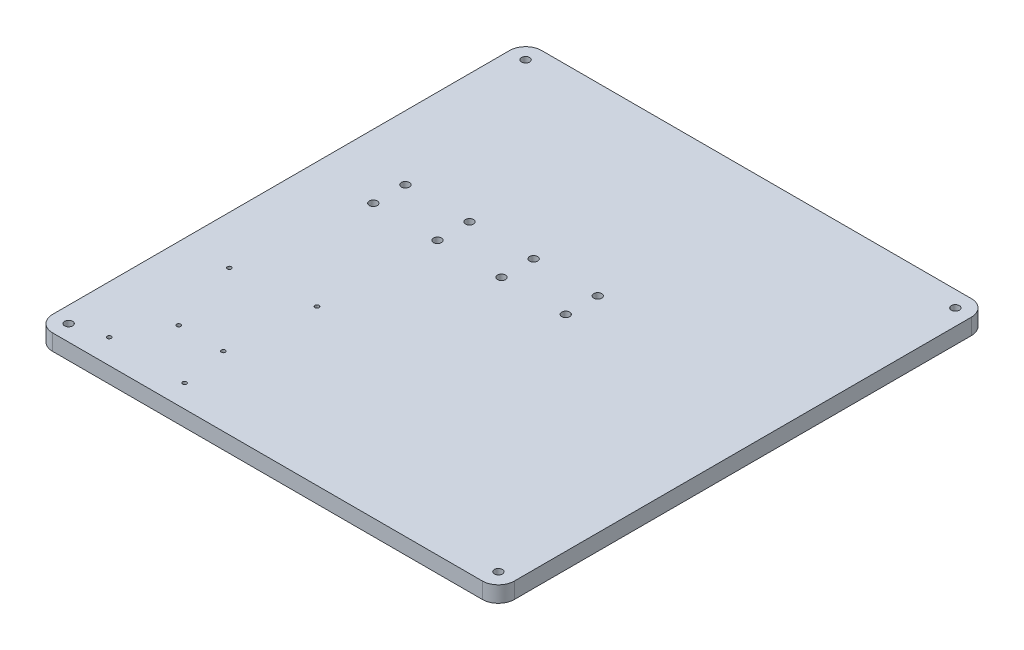
from build123d import *

# Parameters (mm, degrees)
SKETCH1_W           = 288
SKETCH1_H           = 305
SKETCH1_R           = 2.5
SKETCH1_R_2         = 1.25
BOSS_EXTRUDE1_DEPTH = 10
FILLET1_R           = 10


with BuildPart() as part:
    # Sketch1 → Boss-Extrude1 (new body)
    with BuildSketch(Plane(origin=(0, 0, 0), x_dir=(1, 0, 0), z_dir=(0, 1, 0))):
        with Locations((45.382488479, -91.233870968)):
            Rectangle(SKETCH1_W, SKETCH1_H)
        with Locations((-58.617511521, -53.733870968)):
            Circle(SKETCH1_R, mode=Mode.SUBTRACT)
        with Locations((-18.617511521, -53.733870968)):
            Circle(SKETCH1_R, mode=Mode.SUBTRACT)
        with Locations((21.382488479, -53.733870968)):
            Circle(SKETCH1_R, mode=Mode.SUBTRACT)
        with Locations((61.382488479, -53.733870968)):
            Circle(SKETCH1_R, mode=Mode.SUBTRACT)
        with Locations((-18.617511521, -73.733870968)):
            Circle(SKETCH1_R, mode=Mode.SUBTRACT)
        with Locations((21.382488479, -73.733870968)):
            Circle(SKETCH1_R, mode=Mode.SUBTRACT)
        with Locations((61.382488479, -73.733870968)):
            Circle(SKETCH1_R, mode=Mode.SUBTRACT)
        with Locations((-58.617511521, -73.733870968)):
            Circle(SKETCH1_R, mode=Mode.SUBTRACT)
        with Locations((-88.617511521, 51.266129032)):
            Circle(SKETCH1_R, mode=Mode.SUBTRACT)
        with Locations((179.382488479, 51.266129032)):
            Circle(SKETCH1_R, mode=Mode.SUBTRACT)
        with Locations((179.382488479, -233.733870968)):
            Circle(SKETCH1_R, mode=Mode.SUBTRACT)
        with Locations((-88.617511521, -233.733870968)):
            Circle(SKETCH1_R, mode=Mode.SUBTRACT)
        with Locations((-68.617511521, -228.433870968)):
            Circle(SKETCH1_R_2, mode=Mode.SUBTRACT)
        with Locations((-20.417511521, -229.583870968)):
            Circle(SKETCH1_R_2, mode=Mode.SUBTRACT)
        with Locations((-53.417511521, -200.347326658)):
            Circle(SKETCH1_R_2, mode=Mode.SUBTRACT)
        with Locations((-25.517511521, -200.347326658)):
            Circle(SKETCH1_R_2, mode=Mode.SUBTRACT)
        with Locations((-68.617511521, -153.533870968)):
            Circle(SKETCH1_R_2, mode=Mode.SUBTRACT)
        with Locations((-20.417511521, -147.033870968)):
            Circle(SKETCH1_R_2, mode=Mode.SUBTRACT)
    extrude(amount=BOSS_EXTRUDE1_DEPTH)

    # Fillet1
    fillet1_edges = [part.edges().sort_by_distance(p)[0] for p in [
        (189.382488479, 5, -61.266129032),
        (189.382488479, 5, 243.733870968),
        (-98.617511521, 5, 243.733870968),
        (-98.617511521, 5, -61.266129032),
    ]]
    fillet(fillet1_edges, radius=FILLET1_R)


solid = part.part
